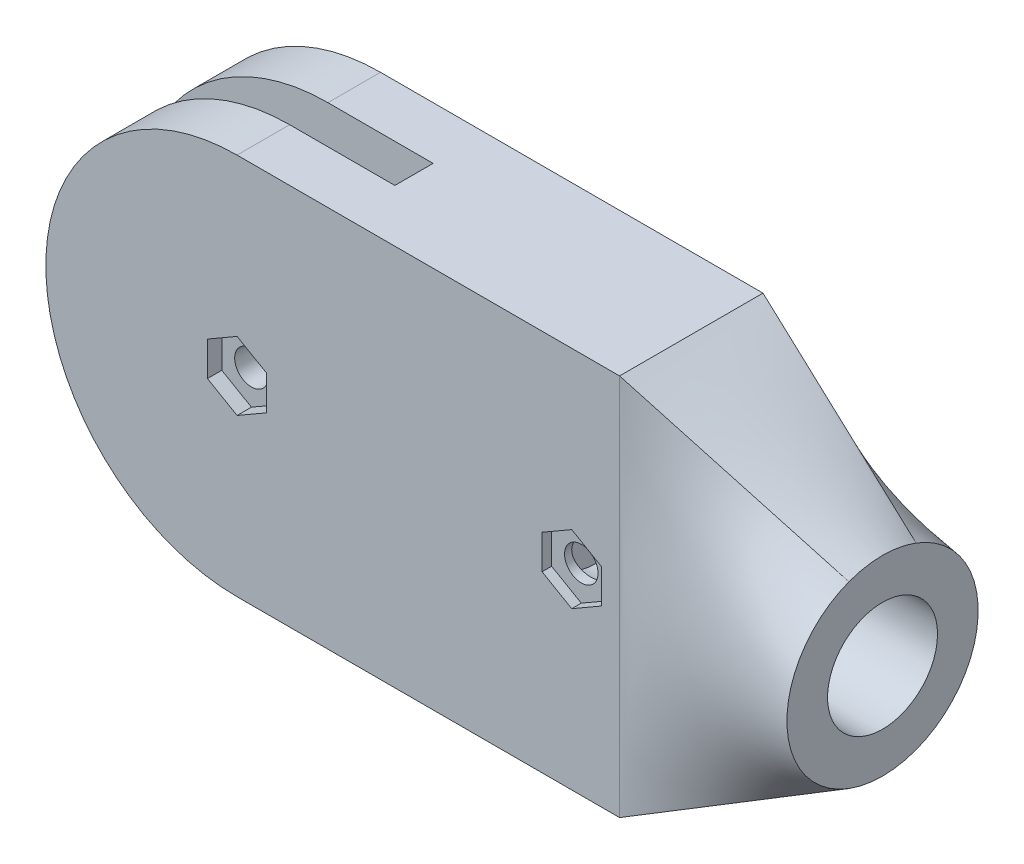
from build123d import *

# Parameters (mm, degrees)
BOSS_EXTRUDE1_DEPTH = 15
CUT_EXTRUDE1_DEPTH  = 1.5
SKETCH3_R           = 1.75
CUT_EXTRUDE2_DEPTH  = 9.5
SKETCH5_W           = 31
SKETCH5_H           = 4
CUT_EXTRUDE3_DEPTH  = 54.5
SKETCH9_R           = 5.75
CUT_EXTRUDE6_DEPTH  = 30
CUT_EXTRUDE7_DEPTH  = 1
CUT_EXTRUDE8_DEPTH  = 36


with BuildPart() as part:
    # Sketch1 → Boss-Extrude1 (new body)
    with BuildSketch(Plane.XY):
        with BuildLine():
            Line((0, 20), (40, 20))
            Line((40, 20), (40, -20))
            Line((40, -20), (0, -20))
            ThreePointArc((0, -20), (-20, 0), (0, 20))
        make_face()
    extrude(amount=BOSS_EXTRUDE1_DEPTH)

    # Sketch2 → Cut-Extrude1 (cut)
    with BuildSketch(Plane.XY.offset(15)):
        Polygon((0, 3.58), (-3.100370946, 1.79), (-3.100370946, -1.79), (0, -3.58), (3.100370946, -1.79), (3.100370946, 1.79), align=None)
    cut_extrude1 = extrude(amount=-CUT_EXTRUDE1_DEPTH, mode=Mode.SUBTRACT)

    # Mirror1: Cut-Extrude1 across plane
    add(cut_extrude1.mirror(Plane.XY.offset(7.5)), mode=Mode.SUBTRACT)

    # Sketch3 → Cut-Extrude2 (cut)
    with BuildSketch(Plane.XY.offset(13.5)):
        Circle(SKETCH3_R)
    extrude(amount=-CUT_EXTRUDE2_DEPTH, mode=Mode.SUBTRACT)

    # Sketch5 → Cut-Extrude3 (cut)
    with BuildSketch(Plane.XZ.offset(20)):
        with Locations((-4.5, 7.5)):
            Rectangle(SKETCH5_W, SKETCH5_H)
    extrude(amount=-CUT_EXTRUDE3_DEPTH, mode=Mode.SUBTRACT)

    # Loft2: read off the stored shape, not the designer's step
    # Loft2: loft between two sections, ruled curve by curve
    loft2_from = [
        Edge.make_bspline([(60, 9.363291776, 3.988765584), (60, 9.089319173, 3.258171977), (60, 8.706678231, 2.497933469), (60, 7.661601681, 1.009485762), (60, 6.997280046, 0.281867871), (60, 5.377038752, -0.99416351), (60, 4.420018042, -1.539958552), (60, 2.836034453, -2.105793102), (60, 2.284258254, -2.252472584), (60, 1.154936709, -2.449606951), (60, 0.57750039, -2.5), (60, -0.57750039, -2.5), (60, -1.154936709, -2.449606951), (60, -2.284258254, -2.252472584), (60, -2.836034453, -2.105793102), (60, -4.420018042, -1.539958552), (60, -5.377038752, -0.99416351), (60, -6.997280046, 0.281867871), (60, -7.661601681, 1.009485762), (60, -8.706678231, 2.497933469), (60, -9.089319173, 3.258171977), (60, -9.363291776, 3.988765584)], [0, 0, 0, 0, 0.125, 0.125, 0.25, 0.25, 0.375, 0.375, 0.4375, 0.4375, 0.5, 0.5, 0.5625, 0.5625, 0.625, 0.625, 0.75, 0.75, 0.875, 0.875, 1, 1, 1, 1], 3),
        Edge.make_bspline([(60, -9.363291776, 3.988765584), (60, -9.568771228, 4.53671079), (60, -9.729102032, 5.111695552), (60, -9.944756725, 6.291183156), (60, -10, 6.895551394), (60, -10, 8.104448606), (60, -9.944756725, 8.708816844), (60, -9.729102032, 9.888304448), (60, -9.568771228, 10.46328921), (60, -9.363291776, 11.011234416)], [0, 0, 0, 0, 0.25, 0.25, 0.5, 0.5, 0.75, 0.75, 1, 1, 1, 1], 3),
        Edge.make_bspline([(60, 9.363291776, 11.011234416), (60, 9.568771228, 10.46328921), (60, 9.729102032, 9.888304448), (60, 9.944756725, 8.708816844), (60, 10, 8.104448606), (60, 10, 6.895551394), (60, 9.944756725, 6.291183156), (60, 9.729102032, 5.111695552), (60, 9.568771228, 4.53671079), (60, 9.363291776, 3.988765584)], [0, 0, 0, 0, 0.25, 0.25, 0.5, 0.5, 0.75, 0.75, 1, 1, 1, 1], 3),
        Edge.make_bspline([(60, -9.363291776, 11.011234416), (60, -9.089319173, 11.741828023), (60, -8.706678231, 12.502066531), (60, -7.661601681, 13.990514238), (60, -6.997280046, 14.718132129), (60, -5.377038752, 15.99416351), (60, -4.420018042, 16.539958552), (60, -2.836034453, 17.105793102), (60, -2.284258254, 17.252472584), (60, -1.154936709, 17.449606951), (60, -0.57750039, 17.5), (60, 0.57750039, 17.5), (60, 1.154936709, 17.449606951), (60, 2.284258254, 17.252472584), (60, 2.836034453, 17.105793102), (60, 4.420018042, 16.539958552), (60, 5.377038752, 15.99416351), (60, 6.997280046, 14.718132129), (60, 7.661601681, 13.990514238), (60, 8.706678231, 12.502066531), (60, 9.089319173, 11.741828023), (60, 9.363291776, 11.011234416)], [0, 0, 0, 0, 0.125, 0.125, 0.25, 0.25, 0.375, 0.375, 0.4375, 0.4375, 0.5, 0.5, 0.5625, 0.5625, 0.625, 0.625, 0.75, 0.75, 0.875, 0.875, 1, 1, 1, 1], 3),
    ]
    loft2_to = [
        Edge.make_bspline([(40, 20, 0), (40, 18.333333333, 0), (40, 16.666666667, 0), (40, 13.333333333, 0), (40, 11.666666667, 0), (40, 8.333333333, 0), (40, 6.666666667, 0), (40, 4.166666667, 0), (40, 3.333333333, 0), (40, 1.666666667, 0), (40, 0.833333333, 0), (40, -0.833333333, 0), (40, -1.666666667, 0), (40, -3.333333333, 0), (40, -4.166666667, 0), (40, -6.666666667, 0), (40, -8.333333333, 0), (40, -11.666666667, 0), (40, -13.333333333, 0), (40, -16.666666667, 0), (40, -18.333333333, 0), (40, -20, 0)], [0, 0, 0, 0, 0.125, 0.125, 0.25, 0.25, 0.375, 0.375, 0.4375, 0.4375, 0.5, 0.5, 0.5625, 0.5625, 0.625, 0.625, 0.75, 0.75, 0.875, 0.875, 1, 1, 1, 1], 3),
        Edge.make_bspline([(40, -20, 0), (40, -20, 1.25), (40, -20, 2.5), (40, -20, 5), (40, -20, 6.25), (40, -20, 8.75), (40, -20, 10), (40, -20, 12.5), (40, -20, 13.75), (40, -20, 15)], [0, 0, 0, 0, 0.25, 0.25, 0.5, 0.5, 0.75, 0.75, 1, 1, 1, 1], 3),
        Edge.make_bspline([(40, 20, 15), (40, 20, 13.75), (40, 20, 12.5), (40, 20, 10), (40, 20, 8.75), (40, 20, 6.25), (40, 20, 5), (40, 20, 2.5), (40, 20, 1.25), (40, 20, 0)], [0, 0, 0, 0, 0.25, 0.25, 0.5, 0.5, 0.75, 0.75, 1, 1, 1, 1], 3),
        Edge.make_bspline([(40, -20, 15), (40, -18.333333333, 15), (40, -16.666666667, 15), (40, -13.333333333, 15), (40, -11.666666667, 15), (40, -8.333333333, 15), (40, -6.666666667, 15), (40, -4.166666667, 15), (40, -3.333333333, 15), (40, -1.666666667, 15), (40, -0.833333333, 15), (40, 0.833333333, 15), (40, 1.666666667, 15), (40, 3.333333333, 15), (40, 4.166666667, 15), (40, 6.666666667, 15), (40, 8.333333333, 15), (40, 11.666666667, 15), (40, 13.333333333, 15), (40, 16.666666667, 15), (40, 18.333333333, 15), (40, 20, 15)], [0, 0, 0, 0, 0.125, 0.125, 0.25, 0.25, 0.375, 0.375, 0.4375, 0.4375, 0.5, 0.5, 0.5625, 0.5625, 0.625, 0.625, 0.75, 0.75, 0.875, 0.875, 1, 1, 1, 1], 3),
    ]
    loft2 = Solid(Shell([*[Face.make_surface_from_curves(loft2_from[k], loft2_to[k]) for k in range(4)], Face(Wire(loft2_from)), Face(Wire(loft2_to))]))
    add(loft2)

    # Sketch9 → Cut-Extrude6 (cut)
    with BuildSketch(Plane(origin=(60, 0, 0), x_dir=(0, 0, -1), z_dir=(1, 0, 0))):
        with Locations((-7.5, 0)):
            Circle(SKETCH9_R)
    extrude(amount=-CUT_EXTRUDE6_DEPTH, mode=Mode.SUBTRACT)

    # Sketch10 → Cut-Extrude7 (cut)
    with BuildSketch(Plane(origin=(0, 0, 0), x_dir=(-1, 0, 0), z_dir=(0, 0, -1))):
        Polygon((-34.996252953, 3.58), (-38.096623899, 1.79), (-38.096623899, -1.79), (-34.996252953, -3.58), (-31.895882008, -1.79), (-31.895882008, 1.79), align=None)
    cut_extrude7 = extrude(amount=-CUT_EXTRUDE7_DEPTH, mode=Mode.SUBTRACT)

    # Mirror4: Cut-Extrude7 across plane
    add(cut_extrude7.mirror(Plane.XY.offset(7.5)), mode=Mode.SUBTRACT)

    # Sketch11 → Cut-Extrude8 (cut)
    with BuildSketch(Plane(origin=(0, 0, 1), x_dir=(-1, 0, 0), z_dir=(0, 0, -1))):
        with BuildLine():
            ThreePointArc((-33.246252953, 0), (-33.758816086, 1.237436867), (-34.996252953, 1.75))
            Line((-34.996252953, 1.75), (-34.996252953, -1.75))
            ThreePointArc((-34.996252953, -1.75), (-33.758816086, -1.237436867), (-33.246252953, 0))
        make_face()
        with BuildLine():
            Line((-34.996252953, -1.75), (-34.996252953, 1.75))
            ThreePointArc((-34.996252953, 1.75), (-36.746252953, 0), (-34.996252953, -1.75))
        make_face()
    extrude(amount=-CUT_EXTRUDE8_DEPTH, mode=Mode.SUBTRACT)


solid = part.part
